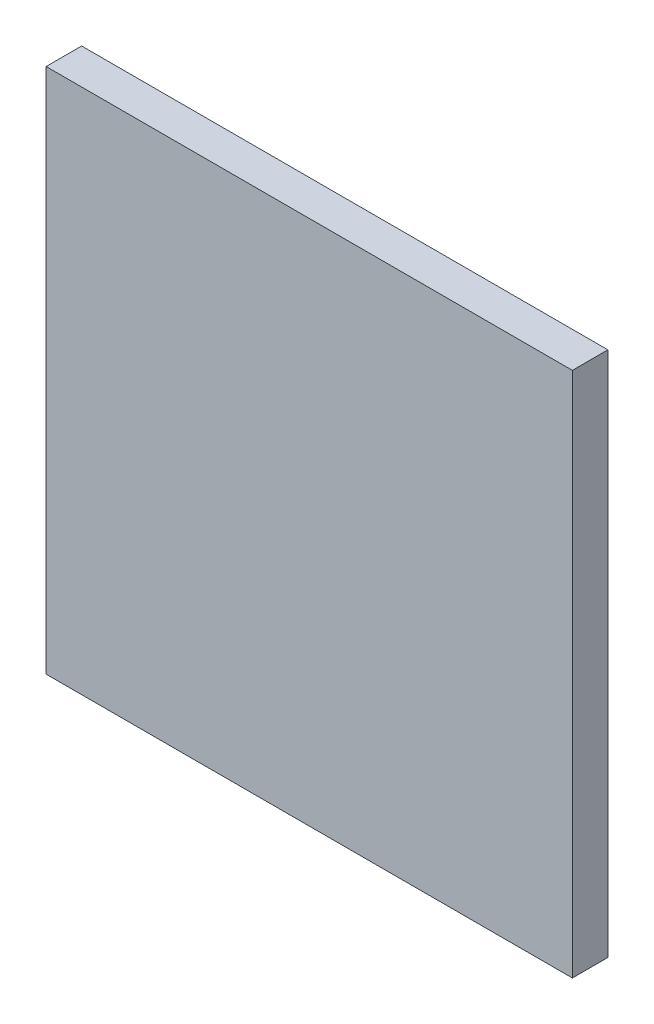
from build123d import *

# Parameters (mm, degrees)
SKETCH1_W      = 44.45
SKETCH1_H      = 44.45
EXTRUDE1_DEPTH = 3


with BuildPart() as part:
    # Sketch1 → Extrude1 (new body)
    with BuildSketch(Plane.XY):
        Rectangle(SKETCH1_W, SKETCH1_H)
    extrude(amount=EXTRUDE1_DEPTH)


solid = part.part
